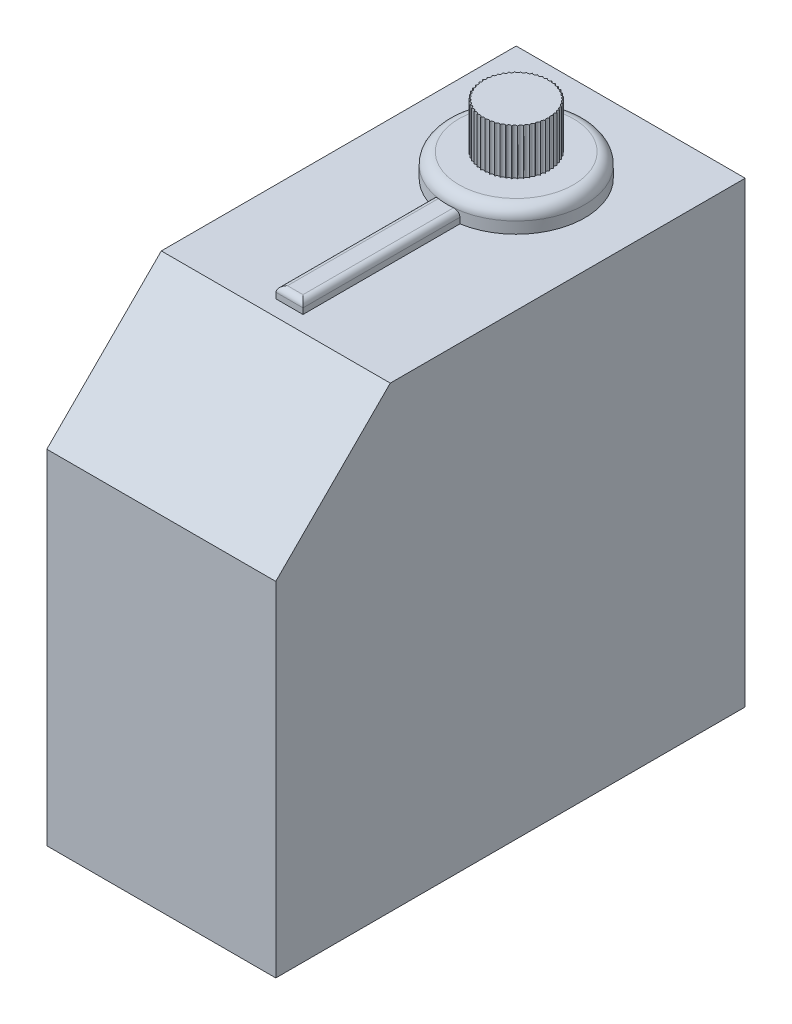
from build123d import *

# Parameters (mm, degrees)
SKETCH1_W           = 20
SKETCH1_H           = 41
BOSS_EXTRUDE1_DEPTH = 40
CHAMFER1_SIZE       = 10
SKETCH2_R           = 6
BOSS_EXTRUDE2_DEPTH = 2
FILLET1_R           = 1
SKETCH3_W           = 2.35715975
SKETCH3_H           = 15.320908912
BOSS_EXTRUDE3_DEPTH = 1
FILLET2_R           = 0.5
SKETCH4_R           = 3
BOSS_EXTRUDE4_DEPTH = 4
SKETCH5_R           = 0.2
CUT_EXTRUDE1_DEPTH  = 4


with BuildPart() as part:
    # Sketch1 → Boss-Extrude1 (new body)
    with BuildSketch(Plane(origin=(0, 0, 0), x_dir=(1, 0, 0), z_dir=(0, 1, 0))):
        with Locations((0, -6.919054605)):
            Rectangle(SKETCH1_W, SKETCH1_H)
    extrude(amount=BOSS_EXTRUDE1_DEPTH)

    # Chamfer1
    chamfer1_edges = [part.edges().sort_by_distance(p)[0] for p in [
        (0, 40, 27.419054605),
    ]]
    chamfer(chamfer1_edges, length=CHAMFER1_SIZE)

    # Sketch2 → Boss-Extrude2 (add)
    with BuildSketch(Plane(origin=(0, 40, 0), x_dir=(1, 0, 0), z_dir=(0, 1, 0))):
        with Locations(Location((0, 3.580945395, 0), (0, 0, 270))):
            Circle(SKETCH2_R)
    extrude(amount=BOSS_EXTRUDE2_DEPTH)

    # Fillet1
    fillet1_edges = [part.edges().sort_by_distance(p)[0] for p in [
        (0, 42, -9.580945395),
    ]]
    fillet(fillet1_edges, radius=FILLET1_R)

    # Sketch3 → Boss-Extrude3 (add)
    with BuildSketch(Plane(origin=(0, 40, 0), x_dir=(1, 0, 0), z_dir=(0, 1, 0))):
        with Locations((-0.179276882, -8.380978437)):
            Rectangle(SKETCH3_W, SKETCH3_H)
    extrude(amount=BOSS_EXTRUDE3_DEPTH)

    # Fillet2
    # the kernel refuses this fillet: 0.5 mm, written as the material it takes off along each edge
    with BuildSketch(Plane(origin=(0.999302993, 41, 1.085252162), x_dir=(-1, 0, 0), z_dir=(0, 0, 1))) as fillet2_piece_1_section:
        with BuildLine():
            CenterArc((FILLET2_R, FILLET2_R), FILLET2_R, 180, 90)
            Line((0, FILLET2_R), (0, 0))
            Line((0, 0), (FILLET2_R, 0))
        make_face()
    fillet2_piece_1 = extrude(amount=16.206180731, mode=Mode.PRIVATE)
    fillet2_piece_1 = fillet2_piece_1 - Plane(origin=(0, 40.888261374, -3.580945395), x_dir=(0, 0, 1), z_dir=(0, -1, 0)) * Cylinder(6, 35, mode=Mode.PRIVATE)
    add(fillet2_piece_1, mode=Mode.SUBTRACT)
    with BuildSketch(Plane(origin=(-1.357856757, 41, 17.291432893), x_dir=(1, 0, 0), z_dir=(0, 0, -1))) as fillet2_piece_2_section:
        with BuildLine():
            CenterArc((FILLET2_R, FILLET2_R), FILLET2_R, 180, 90)
            Line((0, FILLET2_R), (0, 0))
            Line((0, 0), (FILLET2_R, 0))
        make_face()
    fillet2_piece_2 = extrude(amount=16.27804556, mode=Mode.PRIVATE)
    fillet2_piece_2 = fillet2_piece_2 - Plane(origin=(0, 40.888238096, -3.580945395), x_dir=(0, 0, 1), z_dir=(0, -1, 0)) * Cylinder(6, 35, mode=Mode.PRIVATE)
    add(fillet2_piece_2, mode=Mode.SUBTRACT)
    with BuildSketch(Plane(origin=(2.249302993, 41, 16.041432893), x_dir=(0, 0, -1), z_dir=(-1, 0, 0))) as fillet2_piece_3:
        with BuildLine():
            CenterArc((FILLET2_R, FILLET2_R), FILLET2_R, 180, 90)
            Line((0, FILLET2_R), (0, 0))
            Line((0, 0), (FILLET2_R, 0))
        make_face()
    extrude(amount=4.85715975, mode=Mode.SUBTRACT)

    # Sketch4 → Boss-Extrude4 (add)
    with BuildSketch(Plane(origin=(0, 42, 0), x_dir=(1, 0, 0), z_dir=(0, 1, 0))):
        with Locations(Location((0, 3.580945395, 0), (0, 0, 270))):
            Circle(SKETCH4_R)
    extrude(amount=BOSS_EXTRUDE4_DEPTH)

    # Sketch5 → Cut-Extrude1 (cut)
    with BuildSketch(Plane(origin=(0, 46, 0), x_dir=(1, 0, 0), z_dir=(0, 1, 0))):
        with Locations((0, 0.580945395)):
            Circle(SKETCH5_R)
        with Locations((-0.375999701, 0.604601291)):
            Circle(SKETCH5_R)
        with Locations((-0.746069661, 0.675195911)):
            Circle(SKETCH5_R)
        with Locations((-1.104373658, 0.791615937)):
            Circle(SKETCH5_R)
        with Locations((-1.445261022, 0.952025355)):
            Circle(SKETCH5_R)
        with Locations((-1.763355757, 1.153894412)):
            Circle(SKETCH5_R)
        with Locations((-2.053641318, 1.394039512)):
            Circle(SKETCH5_R)
        with Locations((-2.311539728, 1.668673425)):
            Circle(SKETCH5_R)
        with Locations((-2.532983777, 1.97346501)):
            Circle(SKETCH5_R)
        with Locations((-2.714481157, 2.30360752)):
            Circle(SKETCH5_R)
        with Locations((-2.853169549, 2.653894412)):
            Circle(SKETCH5_R)
        with Locations((-2.946861752, 3.018801451)):
            Circle(SKETCH5_R)
        with Locations((-2.994080185, 3.392573836)):
            Circle(SKETCH5_R)
        with Locations((-2.994080185, 3.769316953)):
            Circle(SKETCH5_R)
        with Locations((-2.946861752, 4.143089338)):
            Circle(SKETCH5_R)
        with Locations((-2.853169549, 4.507996378)):
            Circle(SKETCH5_R)
        with Locations((-2.714481157, 4.858283269)):
            Circle(SKETCH5_R)
        with Locations((-2.532983777, 5.18842578)):
            Circle(SKETCH5_R)
        with Locations((-2.311539728, 5.493217364)):
            Circle(SKETCH5_R)
        with Locations((-2.053641318, 5.767851277)):
            Circle(SKETCH5_R)
        with Locations((-1.763355757, 6.007996378)):
            Circle(SKETCH5_R)
        with Locations((-1.445261022, 6.209865435)):
            Circle(SKETCH5_R)
        with Locations((-1.104373658, 6.370274852)):
            Circle(SKETCH5_R)
        with Locations((-0.746069661, 6.486694878)):
            Circle(SKETCH5_R)
        with Locations((-0.375999701, 6.557289499)):
            Circle(SKETCH5_R)
        with Locations((0, 6.580945395)):
            Circle(SKETCH5_R)
        with Locations((0.375999701, 6.557289499)):
            Circle(SKETCH5_R)
        with Locations((0.746069661, 6.486694878)):
            Circle(SKETCH5_R)
        with Locations((1.104373658, 6.370274852)):
            Circle(SKETCH5_R)
        with Locations((1.445261022, 6.209865435)):
            Circle(SKETCH5_R)
        with Locations((1.763355757, 6.007996378)):
            Circle(SKETCH5_R)
        with Locations((2.053641318, 5.767851277)):
            Circle(SKETCH5_R)
        with Locations((2.311539728, 5.493217364)):
            Circle(SKETCH5_R)
        with Locations((2.532983777, 5.18842578)):
            Circle(SKETCH5_R)
        with Locations((2.714481157, 4.858283269)):
            Circle(SKETCH5_R)
        with Locations((2.853169549, 4.507996378)):
            Circle(SKETCH5_R)
        with Locations((2.946861752, 4.143089338)):
            Circle(SKETCH5_R)
        with Locations((2.994080185, 3.769316953)):
            Circle(SKETCH5_R)
        with Locations((2.994080185, 3.392573836)):
            Circle(SKETCH5_R)
        with Locations((2.946861752, 3.018801451)):
            Circle(SKETCH5_R)
        with Locations((2.853169549, 2.653894412)):
            Circle(SKETCH5_R)
        with Locations((2.714481157, 2.30360752)):
            Circle(SKETCH5_R)
        with Locations((2.532983777, 1.97346501)):
            Circle(SKETCH5_R)
        with Locations((2.311539728, 1.668673425)):
            Circle(SKETCH5_R)
        with Locations((2.053641318, 1.394039512)):
            Circle(SKETCH5_R)
        with Locations((1.763355757, 1.153894412)):
            Circle(SKETCH5_R)
        with Locations((1.445261022, 0.952025355)):
            Circle(SKETCH5_R)
        with Locations((1.104373658, 0.791615937)):
            Circle(SKETCH5_R)
        with Locations((0.746069661, 0.675195911)):
            Circle(SKETCH5_R)
        with Locations((0.375999701, 0.604601291)):
            Circle(SKETCH5_R)
    extrude(amount=-CUT_EXTRUDE1_DEPTH, mode=Mode.SUBTRACT)


solid = part.part
